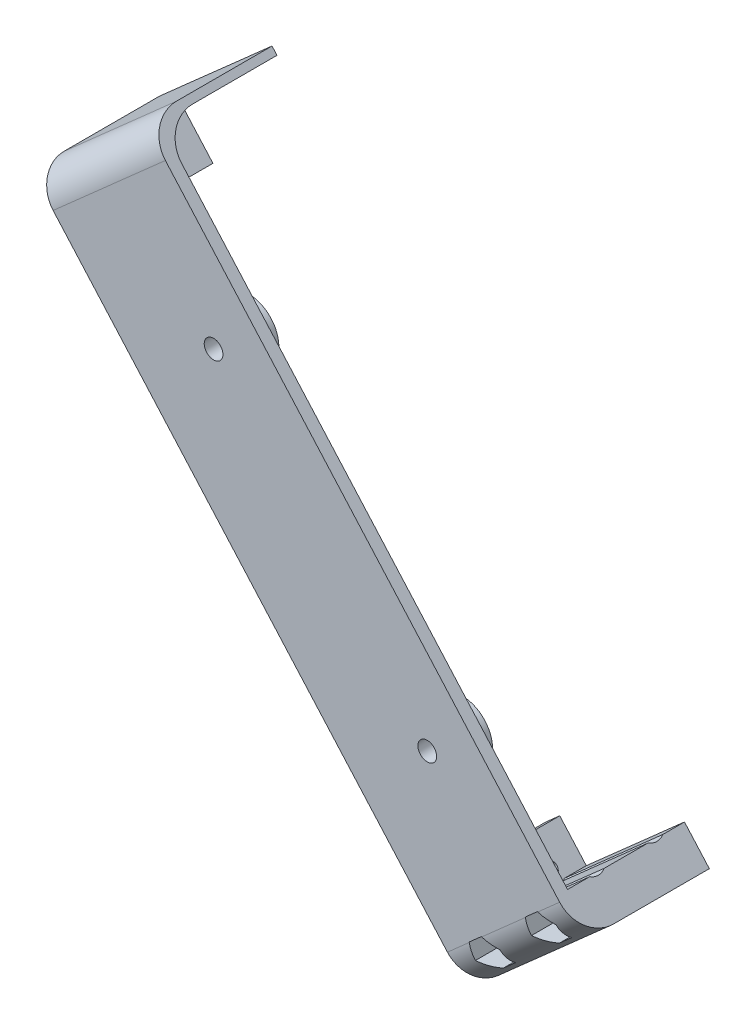
from build123d import *

# Parameters (mm, degrees)
SKETCH1_R                   = 10.2489
BOSS_EXTRUDE1_DEPTH         = 2.9845
BOSS_EXTRUDE1_2_DEPTH       = 2.9845
SKETCH2_R                   = 10.2489
BOSS_EXTRUDE2_DEPTH         = 5.08
BOSS_EXTRUDE3_DEPTH         = 3.81
F_1_4_0_25_DIAMETER_HOLE1_D = 6.35
BOSS_EXTRUDE4_DEPTH         = 17.78
SKETCH8_R                   = 2.25
CUT_EXTRUDE1_DEPTH          = 17.78
SKETCH9_W                   = 17.78
SKETCH9_H                   = 2.54
BOSS_EXTRUDE5_DEPTH         = 17.78
CUT_EXTRUDE2_REACH          = 251.039
CUT_EXTRUDE3_DEPTH          = 20
BOSS_EXTRUDE6_DEPTH         = 2.54
BOSS_EXTRUDE7_DEPTH         = 39.624
CUT_EXTRUDE5_DEPTH          = 6.35
F_6_CLEARANCE_HOLE1_D       = 3.7973
SKETCH19_W                  = 39.624
SKETCH19_H                  = 13.560471889
BOSS_EXTRUDE8_DEPTH         = 6.35
M4_CLEARANCE_HOLE1_D        = 4.5
SKETCH20_R                  = 4.308
CUT_EXTRUDE6_DEPTH          = 195.822050963
FILLET1_R                   = 11
CUT_EXTRUDE7_DEPTH          = 6.35
BOSS_EXTRUDE9_DEPTH         = 21.844


with BuildPart() as part:
    # Sketch1 → Boss-Extrude1 (new body)
    with BuildSketch(Plane.XY):
        Circle(SKETCH1_R)
    extrude(amount=BOSS_EXTRUDE1_DEPTH)



with BuildPart() as body_2:
    # Sketch1 → Boss-Extrude1 2 (new body)
    with BuildSketch(Plane.XY):
        with Locations((-72.411066703, 81.765798589)):
            Circle(SKETCH1_R)
    extrude(amount=BOSS_EXTRUDE1_2_DEPTH)


with BuildPart() as part_1:
    add(part.part)

    add(body_2.part)  # Boss-Extrude2 merges body 2
    # Sketch2 → Boss-Extrude2 (add)
    with BuildSketch(Plane.XY.offset(2.9845)):
        with Locations((-72.411066703, 81.765798589)):
            Circle(SKETCH2_R)
        Circle(SKETCH2_R)
    extrude(amount=BOSS_EXTRUDE2_DEPTH)

    # Sketch3 → Boss-Extrude3 (add)
    with BuildSketch(Plane.XY.offset(8.0645)):
        Polygon((-134.069705847, 103.500499391), (-96.039101852, 137.180065299), (52.150988145, -30.154592279), (14.12038415, -63.834158187), align=None)
    extrude(amount=BOSS_EXTRUDE3_DEPTH)

    # 1/4 (0.25) Diameter Hole1 (through all)
    with Locations(Plane.XY.offset(11.8745)):
        with Locations((0, 0), (-72.411066703, 81.765798589)):
            Hole(F_1_4_0_25_DIAMETER_HOLE1_D / 2)

    # Sketch7 → Boss-Extrude4 (add)
    with BuildSketch(Plane(origin=(0, 0, 8.0645), x_dir=(-1, 0, 0), z_dir=(0, 0, -1))):
        Polygon((53.34482504, 12.346831233), (66.604496657, 27.319509971), (61.850671158, 31.529455709), (48.59099954, 16.556776971), align=None)
        Polygon((120.810034229, 88.527820652), (134.069705847, 103.500499391), (129.315880348, 107.710445129), (116.05620873, 92.737766391), align=None)
    extrude(amount=BOSS_EXTRUDE4_DEPTH)

    # Sketch8 → Cut-Extrude1 (cut)
    with BuildSketch(Plane(origin=(-19.015301997, -16.839782954, 0), x_dir=(0, 0, -1), z_dir=(0.7486339369082552, 0.6629835808745542, 0))):
        with Locations(Location((0.8255, 54.61, 0), (0, 0, 90))):
            Circle(SKETCH8_R)
        with Locations(Location((0.8255, 156.37, 0), (0, 0, 90))):
            Circle(SKETCH8_R)
    extrude(amount=-CUT_EXTRUDE1_DEPTH, mode=Mode.SUBTRACT)

    # Sketch9 → Boss-Extrude5 (add)
    with BuildSketch(Plane(origin=(-19.015301997, -16.839782954, 0), x_dir=(0, 0, -1), z_dir=(0.7486339369082552, 0.6629835808745542, 0))):
        with Locations((0.8255, 63.34)):
            Rectangle(SKETCH9_W, SKETCH9_H)
        with Locations((0.8255, 45.88)):
            Rectangle(SKETCH9_W, SKETCH9_H)
        with Locations((0.8255, 165.1)):
            Rectangle(SKETCH9_W, SKETCH9_H)
        with Locations((0.8255, 147.64)):
            Rectangle(SKETCH9_W, SKETCH9_H)
    extrude(amount=BOSS_EXTRUDE5_DEPTH)

    # Cut-Extrude2: up to this face of the body (flat: up to its plane)
    cut_extrude2_end = Plane(part_1.part.faces().sort_by_distance((-111.777765781, 96.526717556, -0.8255))[0])
    # Sketch10 → Cut-Extrude2 (cut, up to the picked face)
    with BuildSketch(Plane(origin=(-110.30057835, 124.550228083, 0), x_dir=(0.7486339369082557, 0.6629835808745536, 0), z_dir=(-0.6629835808745536, 0.7486339369082557, 0)), mode=Mode.PRIVATE) as cut_extrude2_sk1:
        Polygon((-7.62, 9.7155), (-7.62, -8.0645), (-25.4, 9.7155), align=None)
    cut_extrude2_tool1 = split(extrude(cut_extrude2_sk1.sketch, amount=-CUT_EXTRUDE2_REACH, mode=Mode.PRIVATE), bisect_by=cut_extrude2_end, keep=Keep.BOTH, mode=Mode.PRIVATE)
    add(cut_extrude2_tool1.solids().sort_by(Axis((-120.442073, 115.569011, -3.788833), (0.6629835808745536, -0.7486339369082557, 0)))[0], mode=Mode.SUBTRACT)

    # Sketch11 → Cut-Extrude3 (cut)
    with BuildSketch(Plane(origin=(-42.83536916, 48.369238664, 0), x_dir=(0.7486339369082559, 0.6629835808745536, 0), z_dir=(-0.6629835808745536, 0.7486339369082559, 0))):
        Polygon((-7.62, 9.7155), (-7.62, -8.0645), (-25.4, 9.7155), align=None)
    extrude(amount=-CUT_EXTRUDE3_DEPTH, mode=Mode.SUBTRACT)

    # Sketch13 → Boss-Extrude6 (add)
    with BuildSketch(Plane(origin=(-110.30057835, 124.550228083, 0), x_dir=(0.7486339369082557, 0.6629835808745536, 0), z_dir=(-0.6629835808745536, 0.7486339369082557, 0))):
        Polygon((-25.4, 9.7155), (19.05, 9.7155), (19.05, -8.0645), (-7.62, -8.0645), align=None)
    extrude(amount=-BOSS_EXTRUDE6_DEPTH)

    # Sketch14 → Boss-Extrude7 (add)
    with BuildSketch(Plane(origin=(0, 0, 8.0645), x_dir=(-1, 0, 0), z_dir=(0, 0, -1))):
        Polygon((-52.150988145, -30.154592279), (-14.12038415, -63.834158187), (-5.700492673, -54.326507188), (-43.731096668, -20.64694128), align=None)
    extrude(amount=BOSS_EXTRUDE7_DEPTH)

    # Sketch15 → Cut-Extrude5 (cut)
    with BuildSketch(Plane.XY.offset(11.8745)):
        Polygon((38.433391408, -33.820658256), (42.550325055, -30.174738298), (37.334398928, -28.432329153), (33.21746528, -32.078249111), (33.824088825, -35.052507224), align=None)
        Polygon((43.649317536, -35.563067402), (43.042693991, -32.588809289), (38.433391408, -33.820658256), (34.31645776, -37.466578215), (39.532383888, -39.20898736), align=None)
        Polygon((38.433391408, -33.820658256), (43.042693991, -32.588809289), (42.550325055, -30.174738298), align=None)
        Polygon((34.31645776, -37.466578215), (38.433391408, -33.820658256), (33.824088825, -35.052507224), align=None)
        Polygon((21.198191786, -46.233889763), (19.41808941, -50.660441211), (23.535023058, -47.014521252), align=None)
        Polygon((15.301155763, -54.306361169), (17.637987035, -55.086992658), (19.41808941, -50.660441211), align=None)
        Polygon((14.202163283, -48.918032065), (15.301155763, -54.306361169), (19.41808941, -50.660441211), (21.198191786, -46.233889763), (18.31909693, -45.272112107), align=None)
        Polygon((19.41808941, -50.660441211), (17.637987035, -55.086992658), (20.51708189, -56.048770314), (24.634015538, -52.402850356), (23.535023058, -47.014521252), align=None)
    extrude(amount=-CUT_EXTRUDE5_DEPTH, mode=Mode.SUBTRACT)

    # #6 Clearance Hole1 (through all)
    with Locations(Plane.XY.offset(5.5245)):
        with Locations((19.41808941, -50.660441211), (38.433391408, -33.820658256)):
            Hole(F_6_CLEARANCE_HOLE1_D / 2)

    # Sketch19 → Boss-Extrude8 (add)
    with BuildSketch(Plane(origin=(-23.769127497, -21.049728693, 0), x_dir=(0, 0, 1), z_dir=(-0.7486339369082559, -0.6629835808745536, 0))):
        with Locations((-11.7475, -37.669764056)):
            Rectangle(SKETCH19_W, SKETCH19_H)
    extrude(amount=-BOSS_EXTRUDE8_DEPTH)

    # M4 Clearance Hole1 (through all)
    with Locations(Plane(origin=(-19.015301997, -16.839782954, 0), x_dir=(0, 0, -1), z_dir=(0.7486339369082555, 0.6629835808745539, 0))):
        with Locations((1.866346616, -40.889528111), (21.728039849, -40.889528111)):
            Hole(M4_CLEARANCE_HOLE1_D / 2)

    # Sketch20 → Cut-Extrude6 (cut, through all)
    with BuildSketch(Plane(origin=(-19.015301997, -16.839782954, 0), x_dir=(0, 0, -1), z_dir=(0.7486339369082555, 0.6629835808745539, 0))):
        with Locations((21.728039849, -40.889528111)):
            Circle(SKETCH20_R)
        with Locations((1.866346616, -40.889528111)):
            Circle(SKETCH20_R)
    extrude(amount=CUT_EXTRUDE6_DEPTH, mode=Mode.SUBTRACT)

    # Fillet1
    # the kernel refuses this fillet: 11 mm, written as the material it adds along each edge
    with BuildSketch(Plane(origin=(-127.631902052, 105.808914929, 8.0645), x_dir=(0.6629835808745532, -0.7486339369082561, 1.2918958832001814e-15), z_dir=(0.7486339369082562, 0.6629835808745532, 0))) as fillet1_piece_1:
        with BuildLine():
            CenterArc((FILLET1_R, FILLET1_R), FILLET1_R, 180, 90)
            Line((0, FILLET1_R), (0, 0))
            Line((0, 0), (FILLET1_R, 0))
        make_face()
    extrude(amount=44.45)
    # the kernel refuses this fillet: 11 mm, written as the material it takes off along each edge
    with BuildSketch(Plane(origin=(-154.657139112, 85.268450917, 11.8745), x_dir=(0, 0, -1), z_dir=(0.7486339369082557, 0.6629835808745537, 0))) as fillet1_2_piece_1:
        with BuildLine():
            CenterArc((FILLET1_R, -FILLET1_R), FILLET1_R, 90, 90)
            Line((0, -FILLET1_R), (0, 0))
            Line((0, 0), (FILLET1_R, 0))
        make_face()
    extrude(amount=105.8, mode=Mode.SUBTRACT)
    with BuildSketch(Plane(origin=(72.73842141, -11.922543805, 11.8745), x_dir=(-0.6629835808745536, 0.7486339369082557, 0), z_dir=(-0.7486339369082559, -0.6629835808745537, 0))) as fillet1_2_piece_2:
        with BuildLine():
            CenterArc((FILLET1_R, FILLET1_R), FILLET1_R, 180, 90)
            Line((0, FILLET1_R), (0, 0))
            Line((0, 0), (FILLET1_R, 0))
        make_face()
    extrude(amount=105.8, mode=Mode.SUBTRACT)

    # Sketch23 → Cut-Extrude7 (cut)
    with BuildSketch(Plane.XY.offset(5.5245)):
        Polygon((37.334398928, -28.432329153), (33.21746528, -32.078249111), (34.31645776, -37.466578215), (39.532383888, -39.20898736), (43.649317536, -35.563067402), (42.550325055, -30.174738298), align=None)
        Polygon((14.202163283, -48.918032065), (15.301155763, -54.306361169), (20.51708189, -56.048770314), (24.634015538, -52.402850356), (23.535023058, -47.014521252), (18.31909693, -45.272112107), align=None)
    extrude(amount=-CUT_EXTRUDE7_DEPTH, mode=Mode.SUBTRACT)

    # Sketch24 → Boss-Extrude9 (add)
    with BuildSketch(Plane(origin=(0, 0, -9.7155), x_dir=(-1, 0, 0), z_dir=(0, 0, -1))):
        Polygon((117.740187025, 94.639296591), (116.05620873, 92.737766391), (120.810034229, 88.527820652), (134.069705847, 103.500499391), (96.039101852, 137.180065299), (94.355123557, 135.278535099), (127.631902052, 105.808914929), align=None)
    extrude(amount=BOSS_EXTRUDE9_DEPTH)


solid = part_1.part
